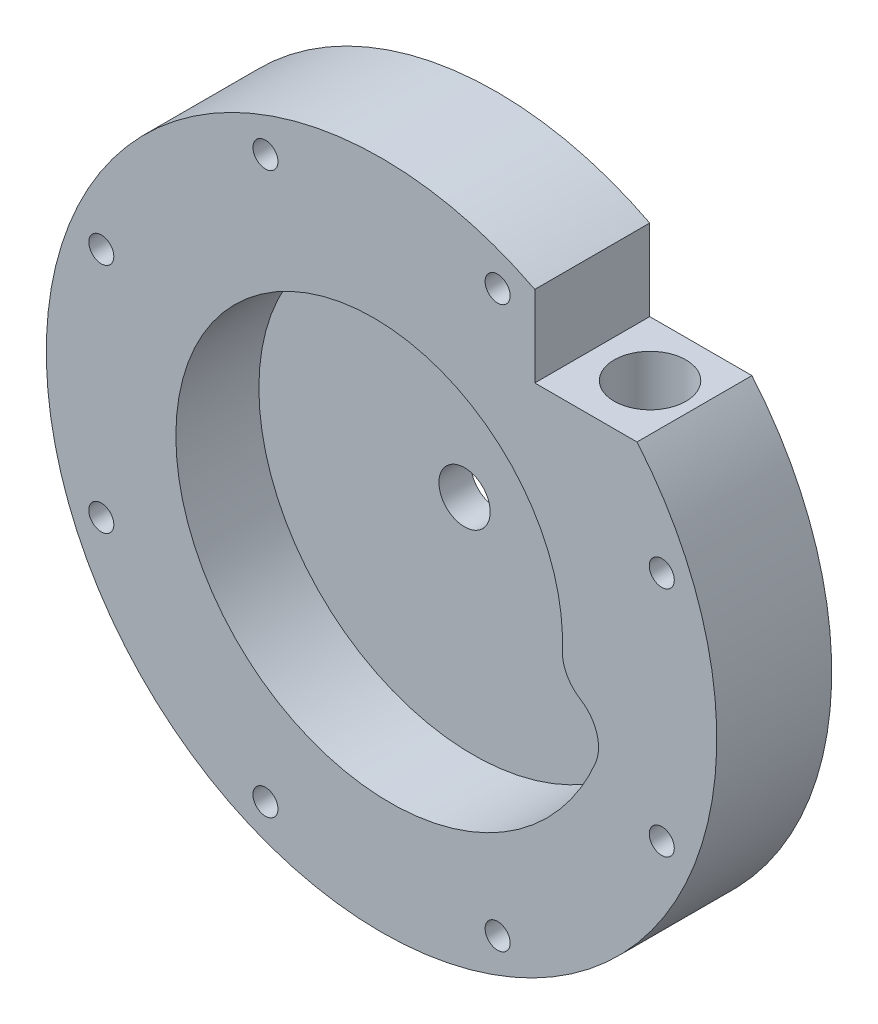
from build123d import *

# Parameters (mm, degrees)
VOLUTE_CUT_DEPTH      = 96.72717143
SKETCH28_W            = 20.323968595
SKETCH28_H            = 16.120297006
OUTLET_HOLE_CUT_DEPTH = 98.024176764
OUTLET_HOLE_D         = 9.8044
OUTLET_HOLE_DEPTH     = 55.88
OUTLET_HOLE_TIP       = 2.945538927
OUTLET_NPT_D          = 14.2748
OUTLET_NPT_DEPTH      = 14.2875
OUTLET_NPT_TIP        = 4.288582582
FASTENER_HOLES_D      = 4.9784
CIRPATTERN1_COUNT     = 8


with BuildPart() as part:
    # Sketch22 → Main Body (revolve)
    with BuildSketch(Plane(origin=(0, 0, 0), x_dir=(1, 0, 0), z_dir=(0, 1, 0))):
        Polygon((-25.4, 0), (-5.1, 0), (-5.1, 6.35), (-11.1125, 6.35), (-11.1125, 4.7625), (-17.4625, 4.7625), (-17.4625, 6.35), (-66.675, 6.35), (-66.675, -16.51), (-25.4, -16.51), align=None)
    revolve(axis=Axis((0, 0, 0), (0, 0, -1)))

    # Sketch23 → Volute Cut (cut, through all)
    with BuildSketch(Plane.XY):
        with BuildLine():
            ThreePointArc((42.554027377, -16.231646763), (42.805320101, -10.94498561), (39.552581276, -6.769865934))
            ThreePointArc((39.552581276, -6.769865934), (36.836858206, -3.87137787), (35.948703812, 0))
            add(Edge.make_bspline(
                [(35.948703812, 0), (35.9515816, 0.07538119), (35.957337916, 0.226162951), (35.964207937, 0.452426553), (35.969771157, 0.678783022), (35.978029534, 1.131847853), (35.980843708, 2.190601907), (35.920311441, 3.779931016), (35.747323363, 5.668216834), (35.489928088, 7.474298946), (35.141459932, 9.268877369), (34.702390603, 11.047358984), (34.17343386, 12.80516853), (33.555538624, 14.537761538), (32.849887572, 16.240636382), (32.057893687, 17.909346365), (31.181197352, 19.53951152), (30.221662701, 21.126830276), (29.181373626, 22.667090912), (28.062629225, 24.156182809), (26.867938753, 25.590107465), (25.60001603, 26.964989265), (24.261773335, 28.277085961), (22.856314773, 29.522798851), (21.386929147, 30.698682629), (19.85708232, 31.801454876), (18.270409111, 32.828005175), (16.630704717, 33.775403815), (14.941915703, 34.640910073), (13.208130556, 35.421980041), (11.43356985, 36.116273987), (9.622576022, 36.721663214), (7.779602801, 37.236236415), (5.909204301, 37.658305492), (4.016023818, 37.986410831), (2.104782347, 38.219326014), (0.180266852, 38.356061949), (-1.75268168, 38.395870413), (-3.689180377, 38.338246992), (-5.624316777, 38.182933409), (-7.553161251, 37.929919231), (-9.470779522, 37.579442948), (-11.37224525, 37.131992419), (-13.252652651, 36.588304682), (-15.107129112, 35.949365124), (-16.930847778, 35.216406011), (-18.719040078, 34.390904381), (-20.467008144, 33.474579298), (-22.170137115, 32.469388481), (-23.823907266, 31.377524301), (-25.42390596, 30.201409162), (-26.965839357, 28.943690275), (-28.445543888, 27.607233836), (-29.858997424, 26.195118613), (-31.202330147, 24.710628968), (-32.471835063, 23.157247319), (-33.663978152, 21.538646066), (-34.775408104, 19.858679), (-35.802965645, 18.121372202), (-36.743692396, 16.330914471), (-37.594839261, 14.491647299), (-38.353874308, 12.608054401), (-39.018490139, 10.68475085), (-39.586610697, 8.726471825), (-40.056397525, 6.738061006), (-40.426255434, 4.724458642), (-40.694837576, 2.690689328), (-40.861049894, 0.641849508), (-40.924054953, -1.416905249), (-40.883275123, -3.480373184), (-40.738395114, -5.543319447), (-40.489363842, -7.600489337), (-40.13639564, -9.646621653), (-39.679970776, -11.676462103), (-39.120835312, -13.684776759), (-38.460000265, -15.666365517), (-37.698740094, -17.61607551), (-36.838590511, -19.528814477), (-35.881345602, -21.399564006), (-34.829054288, -23.223392663), (-33.684016107, -24.995468936), (-32.44877635, -26.711073982), (-31.126120537, -28.365614138), (-29.719068263, -29.954633155), (-28.230866416, -31.473824138), (-26.664981791, -32.919041144), (-25.025093105, -34.286310417), (-23.315082441, -35.571841228), (-21.53902614, -36.772036288), (-19.701185153, -37.883501708), (-17.805994889, -38.903056478), (-15.85805457, -39.827741435), (-13.862116128, -40.654827709), (-11.823072667, -41.381824596), (-9.745946518, -42.006486871), (-7.635876912, -42.526821485), (-5.498107312, -42.941093656), (-3.337972426, -43.247832311), (-1.160884928, -43.445834888), (1.027678058, -43.534171454), (3.222188708, -43.512188152), (5.417082419, -43.379509955), (7.606771886, -43.136042707), (9.785661288, -42.781974466), (11.948160555, -42.317776118), (14.08869967, -41.74420128), (16.201742982, -41.062285471), (18.281803484, -40.273344558), (20.323457017, -39.378972487), (22.321356376, -38.381038284), (24.27024527, -37.281682345), (26.164972102, -36.083312015), (28.000503535, -34.788596469), (29.77193781, -33.400460899), (31.474517775, -31.92208003), (33.103643596, -30.356870964), (34.654885111, -28.708485383), (36.123993806, -26.980801118), (37.506914359, -25.17791311), (38.799795742, -23.304123775), (39.999001844, -21.363932809), (41.101121576, -19.362026441), (41.938186302, -17.641904891), (42.402189205, -16.588613759), (42.554027377, -16.231646763)],
                knots=[0, 0, 0, 0, 0.000879209, 0.001758645, 0.002638305, 0.003518191, 0.007039982, 0.014977213, 0.022047939, 0.029133237, 0.036233164, 0.043347773, 0.050477114, 0.057621232, 0.06478017, 0.071953969, 0.079142669, 0.086346306, 0.093564916, 0.100798534, 0.108047194, 0.115310927, 0.122589766, 0.12988374, 0.13719288, 0.144517215, 0.151856774, 0.159211583, 0.16658167, 0.173967063, 0.181367786, 0.188783866, 0.196215328, 0.203662198, 0.211124498, 0.218602253, 0.226095488, 0.233604225, 0.241128486, 0.248668296, 0.256223676, 0.263794648, 0.271381234, 0.278983456, 0.286601335, 0.294234891, 0.301884146, 0.309549121, 0.317229835, 0.324926308, 0.332638561, 0.340366614, 0.348110485, 0.355870195, 0.363645762, 0.371437205, 0.379244543, 0.387067795, 0.39490698, 0.402762115, 0.410633219, 0.41852031, 0.426423405, 0.434342523, 0.442277682, 0.450228898, 0.458196189, 0.466179572, 0.474179065, 0.482194684, 0.490226447, 0.498274369, 0.506338468, 0.514418761, 0.522515263, 0.530627991, 0.538756962, 0.546902191, 0.555063694, 0.563241488, 0.571435588, 0.57964601, 0.58787277, 0.596115883, 0.604375364, 0.61265123, 0.620943495, 0.629252175, 0.637577285, 0.64591884, 0.654276855, 0.662651345, 0.671042324, 0.679449808, 0.687873812, 0.696314349, 0.704771435, 0.713245083, 0.721735309, 0.730242127, 0.738765551, 0.747305595, 0.755862273, 0.7644356, 0.77302559, 0.781632256, 0.790255613, 0.798895674, 0.807552454, 0.816225965, 0.824916222, 0.833623239, 0.842347028, 0.851087604, 0.859844979, 0.868619169, 0.877410184, 0.88621804, 0.895042749, 0.903884325, 0.912742781, 0.921618129, 0.930510383, 0.935031581, 0.935031581, 0.935031581, 0.935031581], degree=3))
        make_face()
    extrude(amount=VOLUTE_CUT_DEPTH, mode=Mode.SUBTRACT)

    # Sketch28 → Outlet Hole Cut (cut, through all)
    with BuildSketch(Plane.XY.offset(16.51)):
        with Locations((40.641984298, 51.240148503)):
            Rectangle(SKETCH28_W, SKETCH28_H)
    extrude(amount=-OUTLET_HOLE_CUT_DEPTH, mode=Mode.SUBTRACT)

    # Outlet Hole
    with Locations(Plane(origin=(41.529, 43.18, 4.637659), x_dir=(0, 0, 1), z_dir=(0, 1, 0))):
        with Locations((0, 0)):
            Hole(OUTLET_HOLE_D / 2, depth=OUTLET_HOLE_DEPTH)
            with Locations((0, 0, -(OUTLET_HOLE_DEPTH + OUTLET_HOLE_TIP / 2))):  # 118° drill point
                Cone(0, OUTLET_HOLE_D / 2, OUTLET_HOLE_TIP, mode=Mode.SUBTRACT)

    # Outlet NPT
    with Locations(Plane(origin=(41.529, 43.18, 4.637659), x_dir=(0, 0, 1), z_dir=(0, 1, 0))):
        with Locations((0, 0)):
            Hole(OUTLET_NPT_D / 2, depth=OUTLET_NPT_DEPTH)
            with Locations((0, 0, -(OUTLET_NPT_DEPTH + OUTLET_NPT_TIP / 2))):  # 118° drill point
                Cone(0, OUTLET_NPT_D / 2, OUTLET_NPT_TIP, mode=Mode.SUBTRACT)

    # Fastener Holes (through all)
    with Locations(Plane(origin=(55.733032799, -23.085378057, 16.51), x_dir=(1, 0, 0), z_dir=(0, 0, 1))):
        with Locations((0, 0)):
            fastener_holes = Hole(FASTENER_HOLES_D / 2)

    # CirPattern1: Fastener Holes ×8 about axis
    cirpattern1_axis = Axis((0, 0, 0), (0, 0, 1))
    for i in range(1, CIRPATTERN1_COUNT):
        add(fastener_holes.rotate(cirpattern1_axis, i * 360 / CIRPATTERN1_COUNT), mode=Mode.SUBTRACT)


solid = part.part
